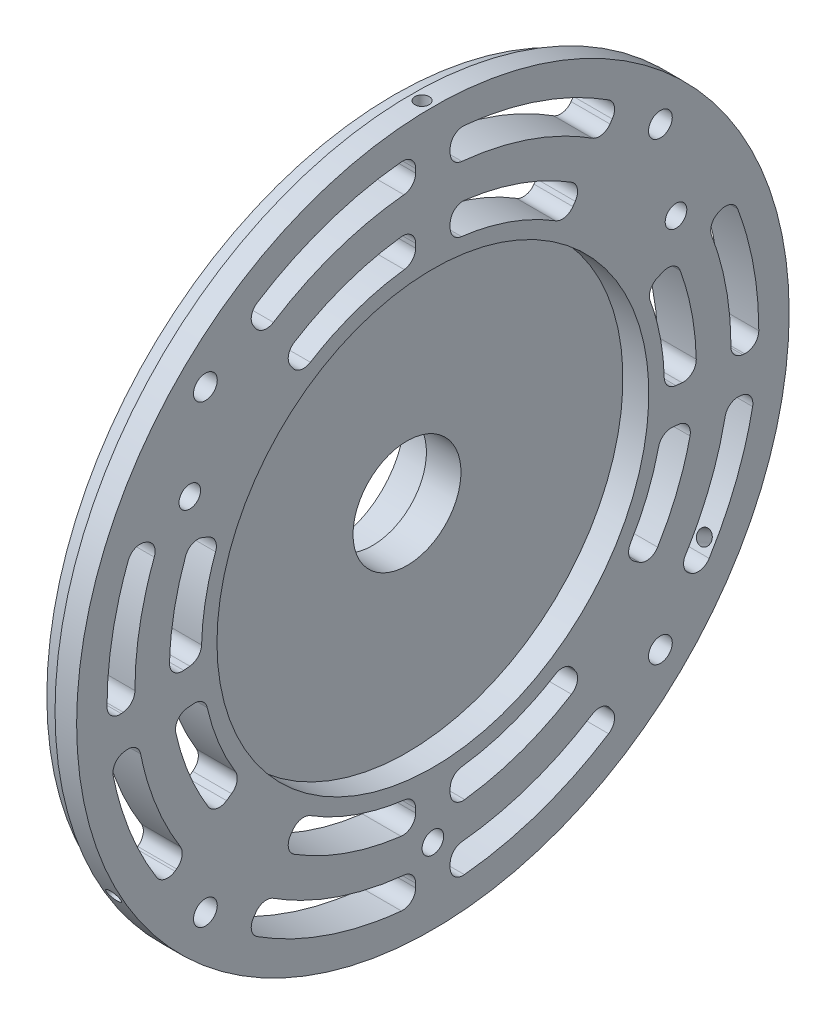
from build123d import *

# Parameters (mm, degrees)
CIRPATTERN1_COUNT        = 4
CIRPATTERN2_COUNT        = 3
RESPIRADOURO1_START      = 11.493419376
RESPIRADOURO1_DEPTH      = 9
FILETE1_R                = 3
CIRPATTERN5_COUNT        = 2
FILETE1_OF_CIRPATTERN5_R = 3
RESPIRADOURO2_START      = 11.493419376
RESPIRADOURO2_DEPTH      = 9
FILETE2_R                = 3
FILETE2_OF_ESPELHAR2_R   = 3
CIRPATTERN7_COUNT        = 3
FILETE3_R                = 1


# Read off the part's stored shape, not the designer's step: Respiradouro1, Respiradouro2
with BuildPart() as part:
    # Esboço1 → Revolução1 (revolve)
    with BuildSketch(Plane.XY, mode=Mode.PRIVATE) as revolu_o1_sk:
        Polygon((-3.506580624, 17.5), (6.493419376, 17.5), (6.493419376, 12.5), (14.493419376, 12.5), (14.493419376, 50), (20.493419376, 50), (20.493419376, 82.5), (15.493419376, 82.5), (15.493419376, 80.4), (11.493419376, 80.4), (11.493419376, 50), (9.493419376, 50), (9.493419376, 25.5), (-3.506580624, 25.5), align=None)
    revolve(revolu_o1_sk.sketch.rotate(Axis((0, 0, 0), (1, 0, 0)), 90), axis=Axis((0, 0, 0), (1, 0, 0)))

    # Esboço3 → Furo de diâmetro Ø5.5 (5.5)1 (revolve, cut)
    with BuildSketch(Plane(origin=(20.493419376, 52.679455198, -52.679455198), x_dir=(0, 0, -1), z_dir=(0, 1, 0))):
        Polygon((0, 0), (0, 21.652366702), (2.75, 20), (2.75, 0), align=None)
    furo_de_di_metro_5_5_5_5_1 = revolve(axis=Axis((26.843419376, 52.679455198, -52.679455198), (-1, 0, 0)), mode=Mode.SUBTRACT)

    # CirPattern1: Furo de diâmetro Ø5.5 (5.5)1 ×4 about axis
    cirpattern1_axis = Axis((0, 0, 0), (1, 0, 0))
    for i in range(1, CIRPATTERN1_COUNT):
        add(furo_de_di_metro_5_5_5_5_1.rotate(cirpattern1_axis, i * 360 / CIRPATTERN1_COUNT), mode=Mode.SUBTRACT)

    # Esboço4 → Furo roscado de M6x1.01 (revolve, cut)
    with BuildSketch(Plane(origin=(20.493419376, -65, 0), x_dir=(0, 0, -1), z_dir=(0, 1, 0))):
        Polygon((0, 0), (0, 18.502151548), (2.5, 17), (2.5, 0), align=None)
    furo_roscado_de_m6x1_01 = revolve(axis=Axis((26.843419376, -65, 0), (-1, 0, 0)), mode=Mode.SUBTRACT)

    # CirPattern2: Furo roscado de M6x1.01 ×3 about axis
    cirpattern2_axis = Axis((0, 0, 0), (1, 0, 0))
    for i in range(1, CIRPATTERN2_COUNT):
        add(furo_roscado_de_m6x1_01.rotate(cirpattern2_axis, i * 360 / CIRPATTERN2_COUNT), mode=Mode.SUBTRACT)

    # Respiradouro1 outline → Respiradouro1 (cut)
    with BuildSketch(Plane.YZ.offset(RESPIRADOURO1_START)):
        with BuildLine():
            add(Edge.make_bspline(
                [(53.175090838, 6.628650766), (53.079995226, 7.390986471), (52.962922664, 8.151679792), (52.339395202, 12.20312589), (51.106480951, 16.113617389), (49.873889899, 20.023083781), (48.060461616, 23.700487122), (46.247597964, 27.376745461), (43.895765185, 30.735693572)],
                knots=[0.601536488, 0.601536488, 0.601536488, 0.625, 0.625, 0.75, 0.75, 0.875, 0.875, 1, 1, 1], degree=2))
            ThreePointArc((53.175090838, 6.628650766), (54.166325878, 4.751217251), (56.152018742, 4))
            Line((56.152018742, 4), (57.118323462, 4))
            ThreePointArc((57.118323462, 4), (59.365052755, 5.011984034), (60.0960126, 7.365195012))
            add(Edge.make_bspline(
                [(51.339278258, 32.094647735), (52.952635449, 29.514272075), (54.301801674, 26.778335206), (56.350711479, 22.623407689), (57.743390296, 18.206201654), (59.136399876, 13.787946526), (59.840917584, 9.210292296), (59.982736598, 8.288813104), (60.0960126, 7.365195012)],
                knots=[0.042665527, 0.042665527, 0.042665527, 0.125, 0.125, 0.25, 0.25, 0.375, 0.375, 0.400156454, 0.400156454, 0.400156454], degree=2))
            ThreePointArc((51.339278258, 32.094647735), (49.393280069, 33.444061712), (47.074846817, 32.961677752))
            Line((47.074846817, 32.961677752), (43.895765185, 30.735693572))
        make_face()
        with BuildLine():
            ThreePointArc((72.124170622, 4), (74.345651228, 4.983809553), (75.110122605, 7.289984055))
            add(Edge.make_bspline(
                [(75.110122605, 7.289984055), (74.906255946, 9.389189326), (74.584541502, 11.479526982), (73.706413642, 17.185157441), (71.970224786, 22.691851289), (70.234366696, 28.197496044), (67.680696488, 33.375989777), (65.127635142, 38.553248823), (61.815801612, 43.283253595)],
                knots=[0.579213223, 0.579213223, 0.579213223, 0.625, 0.625, 0.75, 0.75, 0.875, 0.875, 1, 1, 1], degree=2))
            Line((61.815801612, 43.283253595), (58.555567771, 41.000446861))
            ThreePointArc((58.555567771, 41.000446861), (57.333412353, 39.125670392), (57.748946705, 36.926629266))
            add(Edge.make_bspline(
                [(68.216950971, 6.706306481), (68.033556751, 8.570630358), (67.747811771, 10.427265725), (66.950188249, 15.609845089), (65.373134215, 20.611821684), (63.796403383, 25.612773171), (61.476801947, 30.316607538), (59.794274352, 33.728543312), (57.748946705, 36.926629266)],
                knots=[0.580228714, 0.580228714, 0.580228714, 0.625, 0.625, 0.75, 0.75, 0.875, 0.875, 0.965691079, 0.965691079, 0.965691079], degree=2))
            ThreePointArc((68.216950971, 6.706306481), (69.187730284, 4.777267385), (71.20254038, 4))
            Line((71.20254038, 4), (72.124170622, 4))
        make_face()
        with BuildLine():
            add(Edge.make_bspline(
                [(43.895765185, -30.735693572), (46.247317333, -27.377132925), (48.060461616, -23.700487122), (49.873486427, -20.024083579), (51.106480951, -16.113617389), (52.339144691, -12.204200286), (52.962922664, -8.151679792), (53.080005562, -7.391023175), (53.175107629, -6.62864589)],
                knots=[0, 0, 0, 0.125, 0.125, 0.25, 0.25, 0.375, 0.375, 0.39846875, 0.39846875, 0.39846875], degree=2))
            Line((43.895765185, -30.735693572), (47.074836197, -32.961670316))
            ThreePointArc((47.074836197, -32.961670316), (49.393278883, -33.444052358), (51.339277845, -32.094623974))
            add(Edge.make_bspline(
                [(60.096028677, -7.365196972), (59.982746663, -8.28885906), (59.840917584, -9.210292296), (59.136149365, -13.789020922), (57.743390296, -18.206201654), (56.350300445, -22.624431472), (54.301801674, -26.778335206), (52.952485944, -29.514449932), (51.339277845, -32.094623974)],
                knots=[0.599838756, 0.599838756, 0.599838756, 0.625, 0.625, 0.75, 0.75, 0.875, 0.875, 0.957330843, 0.957330843, 0.957330843], degree=2))
            ThreePointArc((60.096028677, -7.365196972), (59.365069727, -5.011984773), (57.11833978, -4))
            Line((57.11833978, -4), (56.152034924, -4))
            ThreePointArc((56.152034924, -4), (54.166343903, -4.751215625), (53.175107629, -6.62864589))
        make_face()
        with BuildLine():
            Line((58.555558739, -41.000440537), (61.815801612, -43.283253595))
            add(Edge.make_bspline(
                [(61.815801612, -43.283253595), (65.12729559, -38.553747115), (67.680696488, -33.375989777), (70.233955661, -28.198519828), (71.970224786, -22.691851289), (73.706163131, -17.186231838), (74.584541502, -11.479526982), (74.906265623, -9.389329101), (75.110134871, -7.28996612)],
                knots=[0, 0, 0, 0.125, 0.125, 0.25, 0.25, 0.375, 0.375, 0.420792542, 0.420792542, 0.420792542], degree=2))
            ThreePointArc((75.110134871, -7.28996612), (74.345655696, -4.983802882), (72.124181145, -4))
            Line((72.124181145, -4), (71.202551436, -4))
            ThreePointArc((71.202551436, -4), (69.187734811, -4.777273303), (68.216960302, -6.706324021))
            add(Edge.make_bspline(
                [(57.748929669, -36.926635457), (59.794109716, -33.728745404), (61.476801947, -30.316607538), (63.79599991, -25.613772971), (65.373134215, -20.611821684), (66.949937738, -15.610919486), (67.747811771, -10.427265725), (68.033564021, -8.570781286), (68.216960302, -6.706324021)],
                knots=[0.034311022, 0.034311022, 0.034311022, 0.125, 0.125, 0.25, 0.25, 0.375, 0.375, 0.419777149, 0.419777149, 0.419777149], degree=2))
            ThreePointArc((57.748929669, -36.926635457), (57.333404764, -39.125671355), (58.555558739, -41.000440537))
        make_face()
    respiradouro1 = extrude(amount=RESPIRADOURO1_DEPTH, mode=Mode.SUBTRACT)

    # Filete1
    filete1_edges = [part.edges().sort_by_distance(p)[0] for p in [
        (15.993419376, 43.895765185, -30.735693572),
        (15.993419376, 43.895765185, 30.735693572),
        (15.993419376, 61.815801612, 43.283253595),
        (15.993419376, 61.815801612, -43.283253595),
    ]]
    fillet(filete1_edges, radius=FILETE1_R)

    # CirPattern5: Respiradouro1 ×2 about axis
    cirpattern5_axis = Axis((6.493419376, 0, 0), (1, 0, 0))
    for i in range(1, CIRPATTERN5_COUNT):
        add(respiradouro1.rotate(cirpattern5_axis, i * 360 / CIRPATTERN5_COUNT), mode=Mode.SUBTRACT)

    # Filete1 of CirPattern5
    filete1_of_cirpattern5_edges = [part.edges().sort_by_distance(p)[0] for p in [
        (15.993419376, -43.895765185, 30.735693572),
        (15.993419376, -43.895765185, -30.735693572),
        (15.993419376, -61.815801612, -43.283253595),
        (15.993419376, -61.815801612, 43.283253595),
    ]]
    fillet(filete1_of_cirpattern5_edges, radius=FILETE1_OF_CIRPATTERN5_R)

    # Respiradouro2 outline → Respiradouro2 (cut)
    with BuildSketch(Plane.YZ.offset(RESPIRADOURO2_START)):
        with BuildLine():
            add(Edge.make_bspline(
                [(1.380203673, -53.568890242), (1.422012718, -53.567813145), (1.463824228, -53.566670946), (4.831282031, -53.47467938), (8.16168662, -52.961475519), (11.491102874, -52.448423957), (14.73099958, -51.52211825), (17.969693438, -50.596156445), (21.068294123, -49.271269523)],
                knots=[0.623448418, 0.623448418, 0.623448418, 0.625, 0.625, 0.75, 0.75, 0.875, 0.875, 1, 1, 1], degree=2))
            ThreePointArc((1.380203673, -53.568890242), (-0.585574224, -54.371081353), (-1.528063431, -56.273581659))
            Line((-1.528063431, -56.273581659), (-1.667764486, -57.69071479))
            ThreePointArc((-1.667764486, -57.69071479), (-0.882137608, -60.024742398), (1.385952634, -60.984253273))
            add(Edge.make_bspline(
                [(21.049873391, -57.25307731), (18.936984668, -58.029973205), (16.768927854, -58.649834259), (13.08083341, -59.704283614), (9.290797502, -60.288316296), (5.499674425, -60.872516506), (1.666333825, -60.977236175), (1.526131082, -60.981066251), (1.385952634, -60.984253273)],
                knots=[0.051492023, 0.051492023, 0.051492023, 0.125, 0.125, 0.25, 0.25, 0.375, 0.375, 0.379570509, 0.379570509, 0.379570509], degree=2))
            ThreePointArc((21.049873391, -57.25307731), (22.769274149, -55.625472594), (22.772967138, -53.257895259))
            Line((22.772967138, -53.257895259), (21.068294123, -49.271269523))
        make_face()
        with BuildLine():
            ThreePointArc((-3.095009665, -72.16874741), (-2.333894179, -74.476015836), (-0.113864303, -75.463057742))
            add(Edge.make_bspline(
                [(-0.113864303, -75.463057742), (0.973193614, -75.464645932), (2.061420942, -75.434915722), (6.803775276, -75.305355303), (11.493642062, -74.582653201), (16.182421681, -73.860118629), (20.744834282, -72.555687695), (25.305923764, -71.251635052), (29.669288076, -69.385944624)],
                knots=[0.596322918, 0.596322918, 0.596322918, 0.625, 0.625, 0.75, 0.75, 0.875, 0.875, 1, 1, 1], degree=2))
            Line((29.669288076, -69.385944624), (28.283186583, -66.144344718))
            ThreePointArc((28.283186583, -66.144344718), (26.698971824, -64.563168155), (24.461142542, -64.518717799))
            add(Edge.make_bspline(
                [(-0.061313654, -69.000031222), (0.911263653, -69.000848856), (1.884869409, -68.974250756), (6.221015182, -68.855790857), (10.509262748, -68.194980728), (14.796423146, -67.534338129), (18.968131507, -66.341615801), (21.754973297, -65.544837087), (24.461142542, -64.518717799)],
                knots=[0.59694055, 0.59694055, 0.59694055, 0.625, 0.625, 0.75, 0.75, 0.875, 0.875, 0.958530706, 0.958530706, 0.958530706], degree=2))
            ThreePointArc((-0.061313654, -69.000031222), (-2.077480424, -69.776241731), (-3.049364068, -71.705716628))
            Line((-3.049364068, -71.705716628), (-3.095009665, -72.16874741))
        make_face()
        with BuildLine():
            Line((-40.654270363, -59.348477787), (-42.646659574, -62.257034891))
            add(Edge.make_bspline(
                [(-42.646659574, -62.257034891), (-38.732040607, -64.938502187), (-34.512924568, -67.108375067), (-30.294050138, -69.278123687), (-25.835598877, -70.902734764), (-21.378181137, -72.526969236), (-16.751353429, -73.580351485), (-15.689936029, -73.822002637), (-14.62343386, -74.032717301)],
                knots=[0, 0, 0, 0.125, 0.125, 0.25, 0.25, 0.375, 0.375, 0.403682274, 0.403682274, 0.403682274], degree=2))
            ThreePointArc((-14.62343386, -74.032717301), (-12.253406643, -73.498162231), (-11.056419911, -71.383924568))
            Line((-11.056419911, -71.383924568), (-11.010774317, -70.920893823))
            ThreePointArc((-11.010774317, -70.920893823), (-11.587196647, -68.838786071), (-13.412990834, -67.683835431))
            add(Edge.make_bspline(
                [(-36.588385796, -58.500436406), (-34.134865094, -60.03507804), (-31.557046106, -61.360841268), (-27.699542749, -63.34474166), (-23.62289476, -64.830230935), (-19.547280294, -66.315343606), (-15.316674525, -67.278521695), (-14.367060683, -67.494719397), (-13.412990834, -67.683835431)],
                knots=[0.041472609, 0.041472609, 0.041472609, 0.125, 0.125, 0.25, 0.25, 0.375, 0.375, 0.403064972, 0.403064972, 0.403064972], degree=2))
            ThreePointArc((-36.588385796, -58.500436406), (-38.791813111, -58.107076631), (-40.654270363, -59.348477787))
        make_face()
        with BuildLine():
            add(Edge.make_bspline(
                [(-30.28358365, -44.208998846), (-27.503742812, -46.113139977), (-24.507782053, -47.653957196), (-21.512040929, -49.194661457), (-18.345974281, -50.348348983), (-15.180847198, -51.501694139), (-11.89521097, -52.249736589), (-11.854403594, -52.259027225), (-11.8135856, -52.268253466)],
                knots=[0, 0, 0, 0.125, 0.125, 0.25, 0.25, 0.375, 0.375, 0.376552952, 0.376552952, 0.376552952], degree=2))
            Line((-30.28358365, -44.208998846), (-32.733874248, -47.786015868))
            ThreePointArc((-32.733874248, -47.786015868), (-33.192549609, -50.108749644), (-31.824042311, -52.040759751))
            add(Edge.make_bspline(
                [(-13.267258488, -59.539738119), (-13.404095682, -59.509243299), (-13.540828203, -59.478113383), (-17.280990243, -58.62659005), (-20.884008411, -57.313682421), (-24.488060102, -56.000398187), (-27.898258152, -54.246540831), (-29.903686957, -53.215153207), (-31.824042311, -52.040759751)],
                knots=[0.62042895, 0.62042895, 0.62042895, 0.625, 0.625, 0.75, 0.75, 0.875, 0.875, 0.948503309, 0.948503309, 0.948503309], degree=2))
            ThreePointArc((-13.267258488, -59.539738119), (-10.855444544, -59.041592824), (-9.629173873, -56.905883228))
            Line((-9.629173873, -56.905883228), (-9.48947252, -55.488747077))
            ThreePointArc((-9.48947252, -55.488747077), (-10.042318356, -53.438855069), (-11.8135856, -52.268253466))
        make_face()
    respiradouro2 = extrude(amount=RESPIRADOURO2_DEPTH, mode=Mode.SUBTRACT)

    # Filete2
    filete2_edges = [part.edges().sort_by_distance(p)[0] for p in [
        (15.993419376, -42.646659574, -62.257034891),
        (15.993419376, -30.28358365, -44.208998846),
        (15.993419376, 21.068294123, -49.271269523),
        (15.993419376, 29.669288076, -69.385944624),
    ]]
    fillet(filete2_edges, radius=FILETE2_R)

    # Espelhar2: Respiradouro2 across plane
    add(respiradouro2.mirror(Plane.XY), mode=Mode.SUBTRACT)

    # Filete2 of Espelhar2
    filete2_of_espelhar2_edges = [part.edges().sort_by_distance(p)[0] for p in [
        (15.993419376, -42.646659574, 62.257034891),
        (15.993419376, -30.28358365, 44.208998846),
        (15.993419376, 21.068294123, 49.271269523),
        (15.993419376, 29.669288076, 69.385944624),
    ]]
    fillet(filete2_of_espelhar2_edges, radius=FILETE2_OF_ESPELHAR2_R)

    # Esboço8 → Furo roscado de M4x0.71 (revolve, cut)
    with BuildSketch(Plane(origin=(17.993419376, -41.244352694, -71.450355989), x_dir=(0, 0.8660649210732779, -0.4999315478006333), z_dir=(1, 0, 0))):
        Polygon((0, 0), (0, 9.491420021), (1.65, 8.5), (1.65, 0), align=None)
    furo_roscado_de_m4x0_71 = revolve(axis=Axis((17.993419376, -44.418918022, -76.949868237), (0, 0.4999315478006333, 0.8660649210732779)), mode=Mode.SUBTRACT)

    # CirPattern7: Furo roscado de M4x0.71 ×3 about axis
    cirpattern7_axis = Axis((6.493419376, 0, 0), (1, 0, 0))
    for i in range(1, CIRPATTERN7_COUNT):
        add(furo_roscado_de_m4x0_71.rotate(cirpattern7_axis, i * 360 / CIRPATTERN7_COUNT), mode=Mode.SUBTRACT)

    # Filete3
    filete3_edges = [part.edges().sort_by_distance(p)[0] for p in [
        (9.493419376, 0, -50),
        (11.493419376, 0, -50),
    ]]
    fillet(filete3_edges, radius=FILETE3_R - 0.0001)  # a hair under: the kernel refuses the full size


solid = part.part
